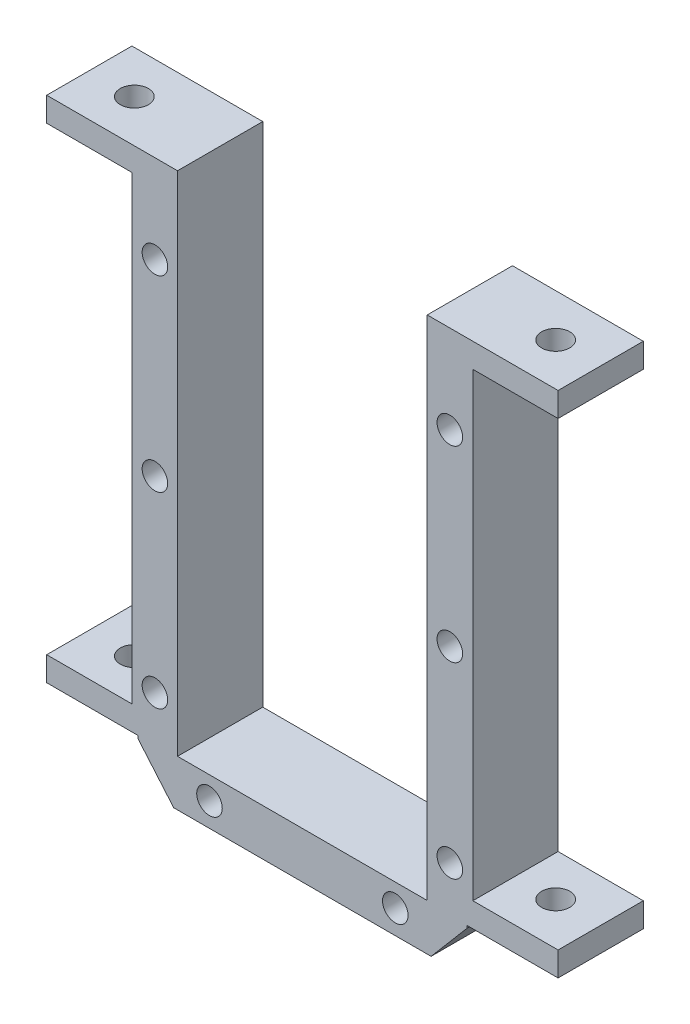
from build123d import *

# Parameters (mm, degrees)
SKETCH1_W               = 40
SKETCH1_H               = 65.1
BOSS_EXTRUDE1_DEPTH     = 10
CUT_EXTRUDE1_DEPTH      = 10
SKETCH4_W               = 29.3
SKETCH4_H               = 59.5
CUT_EXTRUDE2_DEPTH      = 10
SKETCH5_R               = 1.5
CUT_EXTRUDE3_DEPTH      = 10
SKETCH7_W               = 10
SKETCH7_H               = 3
BOSS_EXTRUDE2_DEPTH     = 10
SKETCH8_W               = 10
SKETCH8_H               = 3
BOSS_EXTRUDE3_DEPTH     = 10
SKETCH9_R               = 1.65
CUT_EXTRUDE4_DEPTH      = 68.867591677
SKETCH10_R              = 1.65
CUT_EXTRUDE5_DEPTH      = 68.867591677
ESQUISSE1_W             = 15.35
ESQUISSE1_H             = 0.15
ESQUISSE1_W_2           = 29.3
ENL_V_MAT_EXTRU_1_DEPTH = 46.447909743


with BuildPart() as part:
    # Sketch1 → Boss-Extrude1 (new body)
    with BuildSketch(Plane.XY):
        with Locations((-0.1, 0)):
            Rectangle(SKETCH1_W, SKETCH1_H)
    extrude(amount=BOSS_EXTRUDE1_DEPTH)

    # Sketch2 → Cut-Extrude1 (cut)
    with BuildSketch(Plane.XY.offset(10)):
        Polygon((15, -32.55), (19.335, -27.45), (19.9, -27.45), (19.9, -32.55), align=None)
        Polygon((-20.1, -27.45), (-20.1, -32.55), (-15.2, -32.55), (-19.535, -27.45), align=None)
    extrude(amount=-CUT_EXTRUDE1_DEPTH, mode=Mode.SUBTRACT)

    # Sketch4 → Cut-Extrude2 (cut)
    with BuildSketch(Plane.XY.offset(10)):
        with Locations((-0.1, 2.8)):
            Rectangle(SKETCH4_W, SKETCH4_H)
    extrude(amount=-CUT_EXTRUDE2_DEPTH, mode=Mode.SUBTRACT)

    # Sketch5 → Cut-Extrude3 (cut)
    with BuildSketch(Plane.XY.offset(10)):
        with Locations((-17.4, 22.05)):
            Circle(SKETCH5_R)
        with Locations((-17.4, 0.05)):
            Circle(SKETCH5_R)
        with Locations((-17.4, -21.95)):
            Circle(SKETCH5_R)
        with Locations((-11, -29.75)):
            Circle(SKETCH5_R)
        with Locations((10.8, -29.75)):
            Circle(SKETCH5_R)
        with Locations((17.2, -21.95)):
            Circle(SKETCH5_R)
        with Locations((17.2, 0.05)):
            Circle(SKETCH5_R)
        with Locations((17.2, 22.05)):
            Circle(SKETCH5_R)
    extrude(amount=-CUT_EXTRUDE3_DEPTH, mode=Mode.SUBTRACT)

    # Sketch7 → Boss-Extrude2 (add)
    with BuildSketch(Plane(origin=(19.9, 0, 0), x_dir=(0, 0, -1), z_dir=(1, 0, 0))):
        with Locations((-5, 31.05)):
            Rectangle(SKETCH7_W, SKETCH7_H)
        with Locations((-5, -25.95)):
            Rectangle(SKETCH7_W, SKETCH7_H)
    extrude(amount=BOSS_EXTRUDE2_DEPTH)

    # Sketch8 → Boss-Extrude3 (add)
    with BuildSketch(Plane.ZY.offset(20.1)):
        with Locations((5, 31.05)):
            Rectangle(SKETCH8_W, SKETCH8_H)
        with Locations((5, -25.95)):
            Rectangle(SKETCH8_W, SKETCH8_H)
    extrude(amount=BOSS_EXTRUDE3_DEPTH)

    # Sketch9 → Cut-Extrude4 (cut, through all)
    with BuildSketch(Plane(origin=(0, -27.45, 0), x_dir=(-1, 0, 0), z_dir=(0, -1, 0))):
        with Locations((24.8175, -5)):
            Circle(SKETCH9_R)
    extrude(amount=-CUT_EXTRUDE4_DEPTH, mode=Mode.SUBTRACT)

    # Sketch10 → Cut-Extrude5 (cut, through all)
    with BuildSketch(Plane(origin=(0, -27.45, 0), x_dir=(-1, 0, 0), z_dir=(0, -1, 0))):
        with Locations((-24.6175, -5)):
            Circle(SKETCH10_R)
    extrude(amount=-CUT_EXTRUDE5_DEPTH, mode=Mode.SUBTRACT)

    # Esquisse1 → Enlèv. mat.-Extru.1 (cut, through all)
    with BuildSketch(Plane.XY.offset(10)):
        Polygon((29.9, -27.45), (29.9, -27.3), (19.335, -27.3), (19.185, -27.3), (19.185, -27.905597112), (27.185, -27.905597112), (27.185, -27.45), align=None)
        with Locations((22.225, 32.475)):
            Rectangle(ESQUISSE1_W, ESQUISSE1_H)
        Polygon((-27.385, -27.905597112), (-27.385, -27.45), (-30.1, -27.45), (-30.1, -27.3), (-19.535, -27.3), (-19.385, -27.3), (-19.385, -27.905597112), align=None)
        with Locations((-22.425, 32.475)):
            Rectangle(ESQUISSE1_W, ESQUISSE1_H)
        with Locations((-0.1, -27.025)):
            Rectangle(ESQUISSE1_W_2, ESQUISSE1_H)
    extrude(amount=-ENL_V_MAT_EXTRU_1_DEPTH, mode=Mode.SUBTRACT)


solid = part.part
